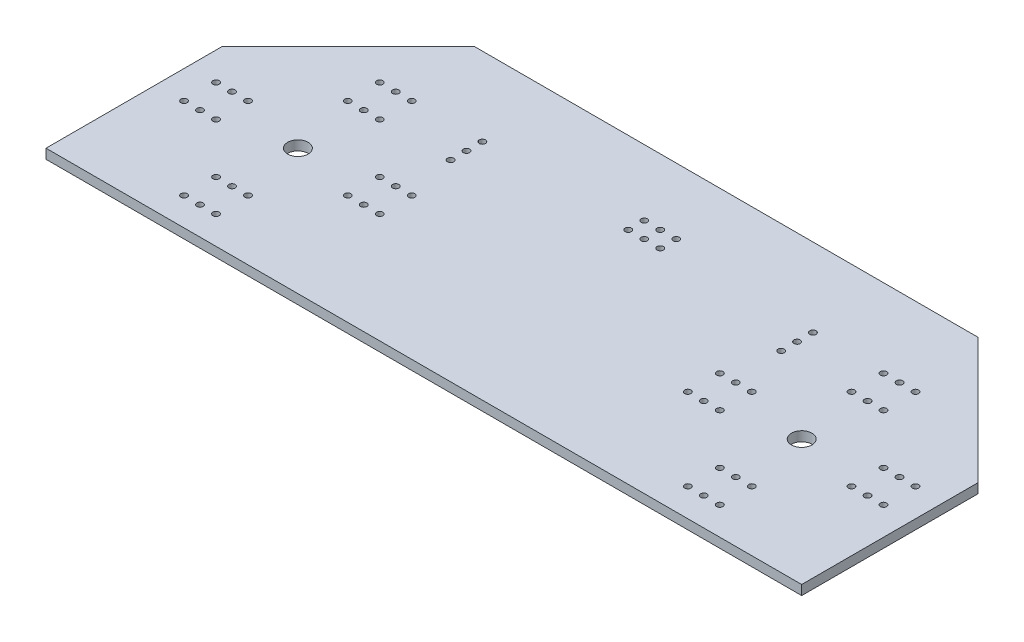
from build123d import *

# Parameters (mm, degrees)
SKETCH1_W           = 120
SKETCH1_H           = 48
BOSS_EXTRUDE1_DEPTH = 1.53
SKETCH2_R           = 0.5
SKETCH2_R_2         = 1.625
CUT_EXTRUDE1_DEPTH  = 67.229456437
SKETCH5_R           = 0.5
CUT_EXTRUDE2_DEPTH  = 67.229456437
CUT_EXTRUDE4_DEPTH  = 67.229456437
SKETCH7_R           = 0.5
CUT_EXTRUDE5_DEPTH  = 67.229456437


with BuildPart() as part:
    # Sketch1 → Boss-Extrude1 (new body)
    with BuildSketch(Plane(origin=(0, 0, 0), x_dir=(1, 0, 0), z_dir=(0, 1, 0))):
        with Locations((0, 4)):
            Rectangle(SKETCH1_W, SKETCH1_H)
    extrude(amount=BOSS_EXTRUDE1_DEPTH)

    # Sketch2 → Cut-Extrude1 (cut, through all)
    with BuildSketch(Plane(origin=(0, 1.53, 0), x_dir=(1, 0, 0), z_dir=(0, 1, 0))):
        with Locations((-55.54, 2.54)):
            Circle(SKETCH2_R)
        with Locations((-53, 2.54)):
            Circle(SKETCH2_R)
        with Locations((-50.46, 2.54)):
            Circle(SKETCH2_R)
        with Locations((-55.54, -2.54)):
            Circle(SKETCH2_R)
        with Locations((-53, -2.54)):
            Circle(SKETCH2_R)
        with Locations((-50.46, -2.54)):
            Circle(SKETCH2_R)
        with Locations((-29.54, 2.54)):
            Circle(SKETCH2_R)
        with Locations((-27, 2.54)):
            Circle(SKETCH2_R)
        with Locations((-24.46, 2.54)):
            Circle(SKETCH2_R)
        with Locations((-29.54, -2.54)):
            Circle(SKETCH2_R)
        with Locations((-27, -2.54)):
            Circle(SKETCH2_R)
        with Locations((-24.46, -2.54)):
            Circle(SKETCH2_R)
        with Locations((-42.54, 15.54)):
            Circle(SKETCH2_R)
        with Locations((-40, 15.54)):
            Circle(SKETCH2_R)
        with Locations((-37.46, 15.54)):
            Circle(SKETCH2_R)
        with Locations((-42.54, 10.46)):
            Circle(SKETCH2_R)
        with Locations((-40, 10.46)):
            Circle(SKETCH2_R)
        with Locations((-37.46, 10.46)):
            Circle(SKETCH2_R)
        with Locations((-42.54, -10.46)):
            Circle(SKETCH2_R)
        with Locations((-40, -10.46)):
            Circle(SKETCH2_R)
        with Locations((-37.46, -10.46)):
            Circle(SKETCH2_R)
        with Locations((-42.54, -15.54)):
            Circle(SKETCH2_R)
        with Locations((-40, -15.54)):
            Circle(SKETCH2_R)
        with Locations((-37.46, -15.54)):
            Circle(SKETCH2_R)
        with Locations((-40, 0)):
            Circle(SKETCH2_R_2)
    cut_extrude1 = extrude(amount=-CUT_EXTRUDE1_DEPTH, mode=Mode.SUBTRACT)

    # Mirror1: Cut-Extrude1 across plane
    add(cut_extrude1.mirror(Plane(origin=(0, 0, 0), x_dir=(0, 0, 1), z_dir=(1, 0, 0))), mode=Mode.SUBTRACT)

    # Sketch5 → Cut-Extrude2 (cut, through all)
    with BuildSketch(Plane(origin=(0, 1.53, 0), x_dir=(1, 0, 0), z_dir=(0, 1, 0))):
        with Locations((-2.54, 17.54)):
            Circle(SKETCH5_R)
        with Locations((0, 17.54)):
            Circle(SKETCH5_R)
        with Locations((2.54, 17.54)):
            Circle(SKETCH5_R)
        with Locations((-2.54, 15)):
            Circle(SKETCH5_R)
        with Locations((0, 15)):
            Circle(SKETCH5_R)
        with Locations((2.54, 15)):
            Circle(SKETCH5_R)
    extrude(amount=-CUT_EXTRUDE2_DEPTH, mode=Mode.SUBTRACT)

    # Sketch6 → Cut-Extrude4 (cut, through all)
    with BuildSketch(Plane(origin=(0, 1.53, 0), x_dir=(1, 0, 0), z_dir=(0, 1, 0))):
        Polygon((-60, 8), (-40, 28), (-60, 28), align=None)
        Polygon((40, 28), (60, 8), (60, 28), align=None)
    extrude(amount=-CUT_EXTRUDE4_DEPTH, mode=Mode.SUBTRACT)

    # Sketch7 → Cut-Extrude5 (cut, through all)
    with BuildSketch(Plane(origin=(0, 1.53, 0), x_dir=(1, 0, 0), z_dir=(0, 1, 0))):
        with Locations((-26.25, 15.54)):
            Circle(SKETCH7_R)
        with Locations((-26.25, 13.02)):
            Circle(SKETCH7_R)
        with Locations((-26.25, 10.5)):
            Circle(SKETCH7_R)
        with Locations((26.25, 10.5)):
            Circle(SKETCH7_R)
        with Locations((26.25, 13.02)):
            Circle(SKETCH7_R)
        with Locations((26.25, 15.54)):
            Circle(SKETCH7_R)
    extrude(amount=-CUT_EXTRUDE5_DEPTH, mode=Mode.SUBTRACT)


solid = part.part
